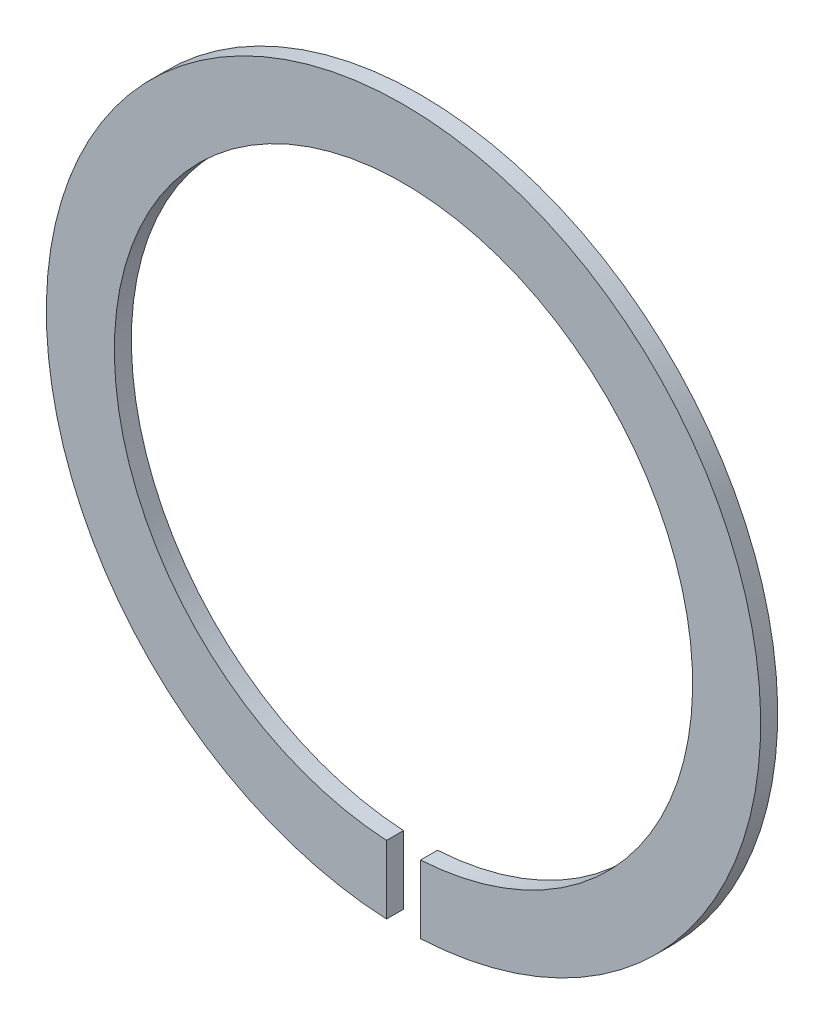
from build123d import *

# Parameters (mm, degrees)
BOSS_EXTRU_1_DEPTH = 0.5


with BuildPart() as part:
    # Esquisse2 → Boss.-Extru.1 (new body)
    with BuildSketch(Plane.XY):
        with BuildLine():
            Line((0.5, -8.485281374), (0.5, -10.488088482))
            ThreePointArc((0.5, -10.488088482), (0, 10.5), (-0.5, -10.488088482))
            Line((-0.5, -10.488088482), (-0.5, -8.485281374))
            ThreePointArc((-0.5, -8.485281374), (0, 8.5), (0.5, -8.485281374))
        make_face()
    extrude(amount=BOSS_EXTRU_1_DEPTH)


solid = part.part
